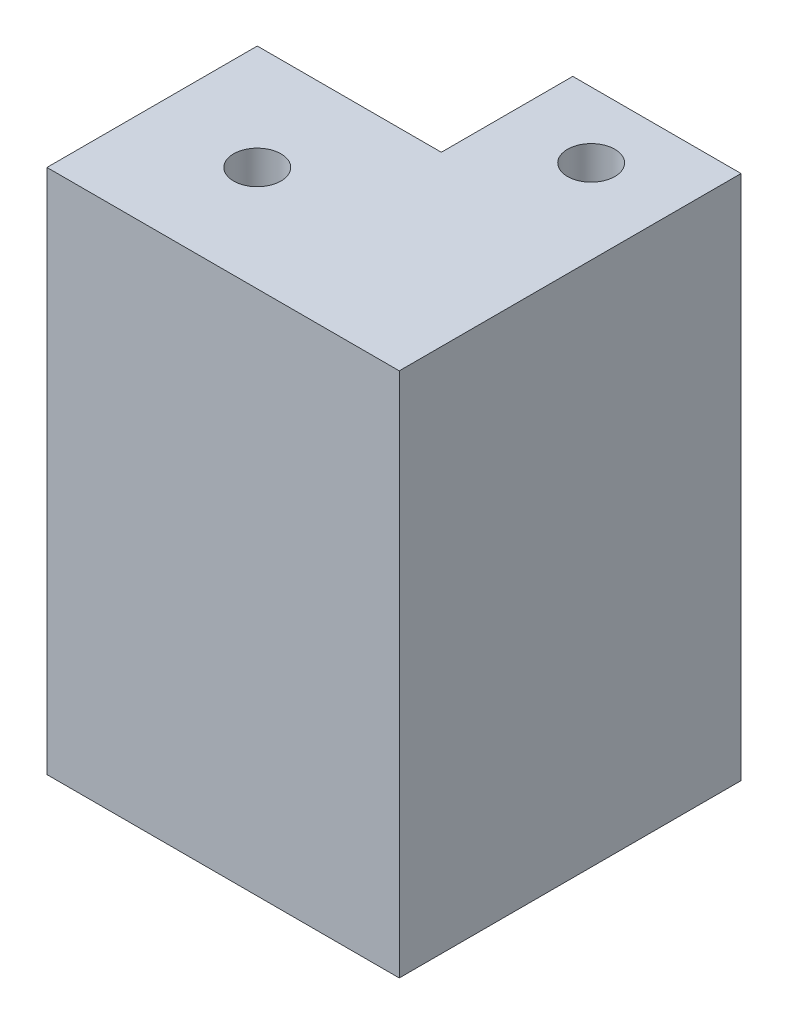
from build123d import *

# Parameters (mm, degrees)
SKETCH1_R                               = 4.5
BOSS_EXTRUDE1_DEPTH                     = 100
CBORE_FOR_M5_HEX_HEAD_BOLT2_D           = 13.5
CBORE_FOR_M5_HEX_HEAD_BOLT2_DEPTH       = 23.85
CBORE_FOR_M5_HEX_HEAD_BOLT2_CBORE_D     = 32
CBORE_FOR_M5_HEX_HEAD_BOLT2_CBORE_DEPTH = 5
CBORE_FOR_M5_HEX_HEAD_BOLT3_D           = 10.2
CBORE_FOR_M5_HEX_HEAD_BOLT3_DEPTH       = 13.5
CBORE_FOR_M5_HEX_HEAD_BOLT3_CBORE_D     = 22
CBORE_FOR_M5_HEX_HEAD_BOLT3_CBORE_DEPTH = 3.5


with BuildPart() as part:
    # Sketch1 → Boss-Extrude1 (new body)
    with BuildSketch(Plane(origin=(0, 0, 0), x_dir=(1, 0, 0), z_dir=(0, 1, 0))):
        Polygon((-35, 0), (0, 0), (0, 25), (32, 25), (32, -40), (-35, -40), align=None)
        with Locations((-15, -20)):
            Circle(SKETCH1_R, mode=Mode.SUBTRACT)
        with Locations((16, 12.5)):
            Circle(SKETCH1_R, mode=Mode.SUBTRACT)
    extrude(amount=BOSS_EXTRUDE1_DEPTH)

    # CBORE for M5 Hex Head Bolt2
    with Locations(Plane(origin=(0, 0, 0), x_dir=(-1, 0, 0), z_dir=(0, -1, 0))):
        with Locations((15, -20)):
            CounterBoreHole(CBORE_FOR_M5_HEX_HEAD_BOLT2_D / 2, CBORE_FOR_M5_HEX_HEAD_BOLT2_CBORE_D / 2, CBORE_FOR_M5_HEX_HEAD_BOLT2_CBORE_DEPTH, depth=CBORE_FOR_M5_HEX_HEAD_BOLT2_DEPTH)

    # CBORE for M5 Hex Head Bolt3
    with Locations(Plane(origin=(0, 0, 0), x_dir=(-1, 0, 0), z_dir=(0, -1, 0))):
        with Locations((-16, 12.5)):
            CounterBoreHole(CBORE_FOR_M5_HEX_HEAD_BOLT3_D / 2, CBORE_FOR_M5_HEX_HEAD_BOLT3_CBORE_D / 2, CBORE_FOR_M5_HEX_HEAD_BOLT3_CBORE_DEPTH, depth=CBORE_FOR_M5_HEX_HEAD_BOLT3_DEPTH)


solid = part.part
